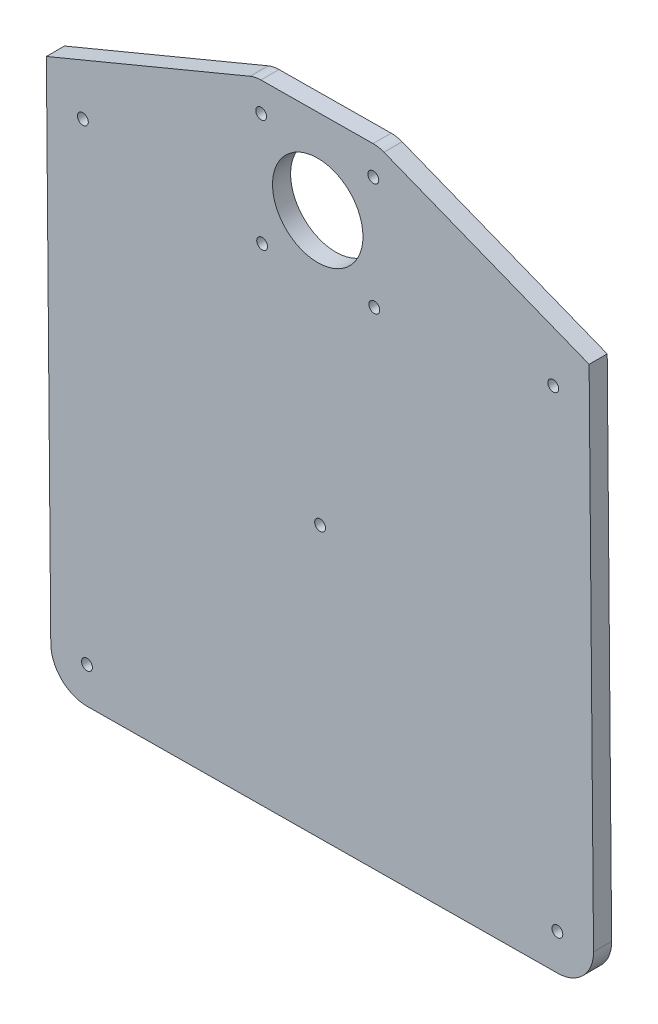
from build123d import *

# Parameters (mm, degrees)
SKETCH1_R             = 1.5
SKETCH1_R_2           = 12.5
BOSS_EXTRUDE1_DEPTH   = 5
BODY_MOVE_COPY1_ANGLE = 119.711745949


with BuildPart() as part:
    # Sketch1 → Boss-Extrude1 (new body)
    with BuildSketch(Plane(origin=(0, 0, 0), x_dir=(1, 0, 0), z_dir=(0, 1, 0))):
        with BuildLine():
            Line((-75, -75), (65, -75))
            ThreePointArc((65, -75), (72.071067812, -72.071067812), (75, -65))
            Line((75, -65), (75, 65))
            ThreePointArc((75, 65), (72.071067812, 72.071067812), (65, 75))
            Line((65, 75), (-75, 75))
            Line((-75, 75), (-97.913420794, 18.506857518))
            ThreePointArc((-97.913420794, 18.506857518), (-98.351985938, 17.031769181), (-98.5, 15.5))
            Line((-98.5, 15.5), (-98.5, -15.5))
            ThreePointArc((-98.5, -15.5), (-98.351985938, -17.031769181), (-97.913420794, -18.506857518))
            Line((-97.913420794, -18.506857518), (-75, -75))
        make_face()
        with Locations((-90.5, 15.5)):
            Circle(SKETCH1_R, mode=Mode.SUBTRACT)
        with Locations((-90.5, -15.5)):
            Circle(SKETCH1_R, mode=Mode.SUBTRACT)
        with Locations((-59.5, -15.5)):
            Circle(SKETCH1_R, mode=Mode.SUBTRACT)
        with Locations((-59.5, 15.5)):
            Circle(SKETCH1_R, mode=Mode.SUBTRACT)
        with Locations((-75, 0)):
            Circle(SKETCH1_R_2, mode=Mode.SUBTRACT)
        with Locations((-65, 65)):
            Circle(SKETCH1_R, mode=Mode.SUBTRACT)
        with Locations((65, 65)):
            Circle(SKETCH1_R, mode=Mode.SUBTRACT)
        with Locations((65, -65)):
            Circle(SKETCH1_R, mode=Mode.SUBTRACT)
        with Locations((-65, -65)):
            Circle(SKETCH1_R, mode=Mode.SUBTRACT)
        Circle(SKETCH1_R, mode=Mode.SUBTRACT)
    extrude(amount=BOSS_EXTRUDE1_DEPTH)


with BuildPart() as part_1:
    # Body-Move/Copy1: moved
    add(part.part.moved(Location((0, 0, 0))).rotate(Axis((-6.951895858, -2.256414426, 4.756414426), (-0.5807091426084982, 0.5756634831611324, -0.5756634831615567)), BODY_MOVE_COPY1_ANGLE))


with BuildPart() as part_2:
    # Body-Move/Copy2: moved
    add(part_1.part.moved(Location((11.64746321, 9.2495526, 0))))


solid = part_2.part
